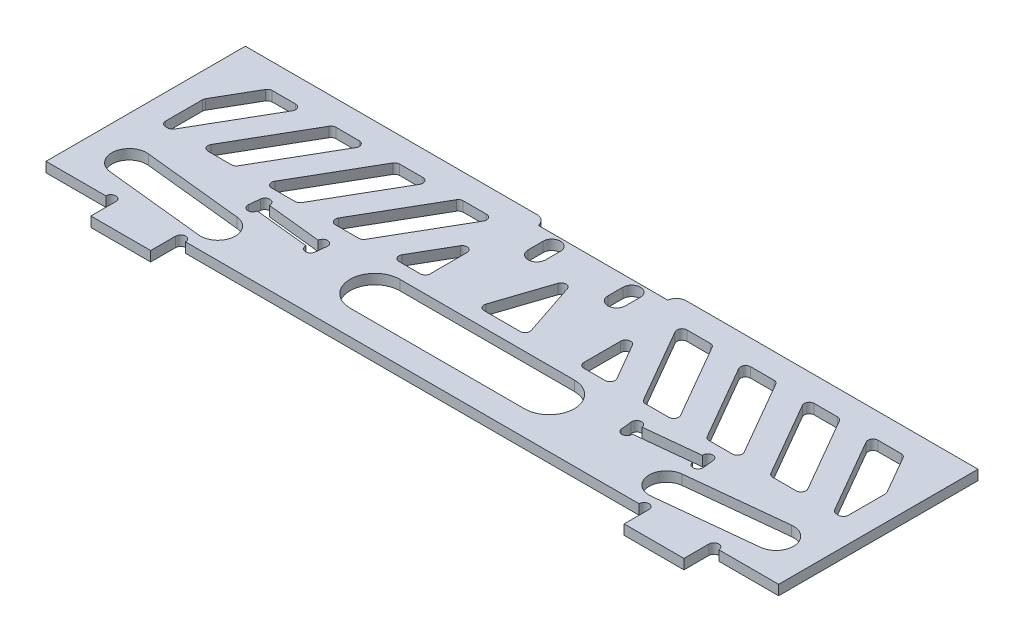
from build123d import *

# Parameters (mm, degrees)
SKETCH_1_W          = 147
SKETCH_1_H          = 40
EXTRUDE_1_DEPTH     = 2
CUT_EXTRUDE_1_DEPTH = 77.198753271
SKETCH_3_R          = 1
CUT_EXTRUDE_2_DEPTH = 77.198753271
SKETCH_5_W          = 12
SKETCH_5_H          = 2
EXTRUDE_2_DEPTH     = 5
SKETCH_7_R          = 1
CUT_EXTRUDE_3_DEPTH = 78.661122835
CUT_EXTRUDE_5_DEPTH = 78.661122835
SKETCH_11_W         = 26
SKETCH_11_H         = 3.5
CUT_EXTRUDE_6_DEPTH = 10
FILLET_1_R          = 2
CUT_EXTRUDE_7_DEPTH = 78.661122835
CUT_EXTRUDE_8_DEPTH = 10
FILLET_2_R          = 1
CUT_EXTRUDE_9_DEPTH = 10
FILLET_3_R          = 1


with BuildPart() as part:
    # 草图1 → 凸台-拉伸1 (new body)
    with BuildSketch(Plane(origin=(0, 0, 0), x_dir=(1, 0, 0), z_dir=(0, 1, 0))):
        Rectangle(SKETCH_1_W, SKETCH_1_H)
    extrude(amount=EXTRUDE_1_DEPTH)

    # 草图2 → 切除-拉伸1 (cut, through all)
    with BuildSketch(Plane(origin=(0, 2, 0), x_dir=(1, 0, 0), z_dir=(0, 1, 0))):
        Polygon((-45.658720859, -7.223049229), (-45.42875824, -5.035101059), (-30.51092981, -6.603028008), (-30.740892429, -8.790976178), align=None)
    cut_extrude_1 = extrude(amount=-CUT_EXTRUDE_1_DEPTH, mode=Mode.SUBTRACT)

    # 草图3 → 切除-拉伸2 (cut, through all)
    with BuildSketch(Plane(origin=(0, 2, 0), x_dir=(1, 0, 0), z_dir=(0, 1, 0))):
        with Locations((-44.434236345, -5.139629522)):
            Circle(SKETCH_3_R)
        with Locations((-44.664198964, -7.327577692)):
            Circle(SKETCH_3_R)
        with Locations((-31.505451705, -6.498499545)):
            Circle(SKETCH_3_R)
        with Locations((-31.735414324, -8.686447714)):
            Circle(SKETCH_3_R)
    cut_extrude_2 = extrude(amount=-CUT_EXTRUDE_2_DEPTH, mode=Mode.SUBTRACT)

    # 镜向1: 切除-拉伸1, 切除-拉伸2 across plane
    add(cut_extrude_1.mirror(Plane(origin=(0, 0, 0), x_dir=(0, 0, 1), z_dir=(1, 0, 0))), mode=Mode.SUBTRACT)
    add(cut_extrude_2.mirror(Plane(origin=(0, 0, 0), x_dir=(0, 0, 1), z_dir=(1, 0, 0))), mode=Mode.SUBTRACT)

    # 草图5 → 凸台-拉伸2 (add)
    with BuildSketch(Plane.XY.offset(20)):
        with Locations((53.5, 1)):
            Rectangle(SKETCH_5_W, SKETCH_5_H)
        with Locations((-53.5, 1)):
            Rectangle(SKETCH_5_W, SKETCH_5_H)
    extrude(amount=EXTRUDE_2_DEPTH)

    # 草图7 → 切除-拉伸3 (cut, through all)
    with BuildSketch(Plane(origin=(0, 2, 0), x_dir=(1, 0, 0), z_dir=(0, 1, 0))):
        with Locations((60.5, -20)):
            Circle(SKETCH_7_R)
        with Locations((46.5, -20)):
            Circle(SKETCH_7_R)
        with Locations((-46.5, -20)):
            Circle(SKETCH_7_R)
        with Locations((-60.5, -20)):
            Circle(SKETCH_7_R)
    extrude(amount=-CUT_EXTRUDE_3_DEPTH, mode=Mode.SUBTRACT)

    # 草图10 → 切除-拉伸5 (cut, through all)
    with BuildSketch(Plane(origin=(0, 2, 0), x_dir=(1, 0, 0), z_dir=(0, 1, 0))):
        with BuildLine():
            Line((-64.524588286, -8.428604101), (-44.634150379, -10.519173366))
            ThreePointArc((-44.634150379, -10.519173366), (-41.519173366, -14.365849621), (-45.365849621, -17.480826634))
            Line((-45.365849621, -17.480826634), (-65.256287529, -15.390257368))
            ThreePointArc((-65.256287529, -15.390257368), (-68.371264541, -11.543581113), (-64.524588286, -8.428604101))
        make_face()
    cut_extrude_5 = extrude(amount=-CUT_EXTRUDE_5_DEPTH, mode=Mode.SUBTRACT)

    # 镜向2: 切除-拉伸5 across plane
    add(cut_extrude_5.mirror(Plane(origin=(0, 0, 0), x_dir=(0, 0, 1), z_dir=(1, 0, 0))), mode=Mode.SUBTRACT)

    # 草图11 → 切除-拉伸6 (cut)
    with BuildSketch(Plane(origin=(0, 2, 0), x_dir=(1, 0, 0), z_dir=(0, 1, 0))):
        with Locations((0, 20)):
            Rectangle(SKETCH_11_W, SKETCH_11_H)
    extrude(amount=-CUT_EXTRUDE_6_DEPTH, mode=Mode.SUBTRACT)

    # 圆角1
    # the kernel refuses this fillet: 2 mm, written as the material it takes off along each edge
    with BuildSketch(Plane(origin=(13, -4.960783708, -20), x_dir=(1, 0, 0), z_dir=(0, 1, 0)), Plane(origin=(-13, 6.960783708, -20), x_dir=(-1, 0, 0), z_dir=(0, -1, 0))) as fillet_1_piece_1:
        with BuildLine():
            CenterArc((1.984313483, -2), FILLET_1_R, 90, 82.819244219)
            Line((0, -1.75), (-0.03968627, -1.745))
            ThreePointArc((-0.03968627, -1.745), (-0.04, -0.875), (-0.04, 0))
            Line((-0.04, 0), (0, 0.04))
            Line((0, 0.04), (1.984313483, 0.04))
            Line((1.984313483, 0.04), (1.984313483, 0))
        make_face()
    extrude(amount=11.921567416, mode=Mode.SUBTRACT)

    # 草图12 → 切除-拉伸7 (cut, through all)
    with BuildSketch(Plane(origin=(0, 2, 0), x_dir=(1, 0, 0), z_dir=(0, 1, 0))):
        with BuildLine():
            Line((-6.25, 16), (-6.25, 13))
            ThreePointArc((-6.25, 13), (-8, 11.25), (-9.75, 13))
            Line((-9.75, 13), (-9.75, 16))
            ThreePointArc((-9.75, 16), (-8, 17.75), (-6.25, 16))
        make_face()
        with BuildLine():
            Line((9.75, 16), (9.75, 13))
            ThreePointArc((9.75, 13), (8, 11.25), (6.25, 13))
            Line((6.25, 13), (6.25, 16))
            ThreePointArc((6.25, 16), (8, 17.75), (9.75, 16))
        make_face()
    extrude(amount=-CUT_EXTRUDE_7_DEPTH, mode=Mode.SUBTRACT)

    # 草图13 → 切除-拉伸8 (cut)
    with BuildSketch(Plane(origin=(0, 2, 0), x_dir=(1, 0, 0), z_dir=(0, 1, 0))):
        with BuildLine():
            Line((-17.5, -5), (17.5, -5))
            ThreePointArc((17.5, -5), (22.5, -10), (17.5, -15))
            Line((17.5, -15), (-17.5, -15))
            ThreePointArc((-17.5, -15), (-22.5, -10), (-17.5, -5))
        make_face()
        Polygon((0, 13), (-5, -2), (5, -2), align=None)
    extrude(amount=-CUT_EXTRUDE_8_DEPTH, mode=Mode.SUBTRACT)

    # 圆角2
    fillet_2_edges = [part.edges().sort_by_distance(p)[0] for p in [
        (0, 1, -13),
        (5, 1, 2),
        (-5, 1, 2),
    ]]
    fillet(fillet_2_edges, radius=FILLET_2_R)

    # 草图14 → 切除-拉伸9 (cut)
    with BuildSketch(Plane(origin=(0, 2, 0), x_dir=(1, 0, 0), z_dir=(0, 1, 0))):
        Polygon((-56.685045424, 15), (-63.685045424, 15), (-68.5, 6.660254038), (-68.5, -2), (-66.5, -2), align=None)
        Polygon((-60.726497308, -2), (-53.726497308, -2), (-43.911542732, 15), (-50.911542732, 15), align=None)
        Polygon((-47.952994616, -2), (-40.952994616, -2), (-31.13804004, 15), (-38.13804004, 15), align=None)
        Polygon((-35.179491924, -2), (-28.179491924, -2), (-18.364537348, 15), (-25.364537348, 15), align=None)
        Polygon((-22.405989232, -2), (-15.405989232, -2), (-15.405989232, 10.124355653), align=None)
        Polygon((15.405989232, 10.124355653), (22.405989232, -2), (15.405989232, -2), align=None)
        Polygon((18.364537348, 15), (25.364537348, 15), (35.179491924, -2), (28.179491924, -2), align=None)
        Polygon((40.952994616, -2), (31.13804004, 15), (38.13804004, 15), (47.952994616, -2), align=None)
        Polygon((43.911542732, 15), (50.911542732, 15), (60.726497308, -2), (53.726497308, -2), align=None)
        Polygon((68.5, -2), (68.5, 6.660254038), (63.685045424, 15), (56.685045424, 15), (66.5, -2), align=None)
    extrude(amount=-CUT_EXTRUDE_9_DEPTH, mode=Mode.SUBTRACT)

    # 圆角3
    fillet_3_edges = [part.edges().sort_by_distance(p)[0] for p in [
        (-28.179491924, 1, 2),
        (-35.179491924, 1, 2),
        (-25.364537348, 1, -15),
        (-18.364537348, 1, -15),
        (-15.405989232, 1, 2),
        (-22.405989232, 1, 2),
        (-15.405989232, 1, -10.124355653),
        (-53.726497308, 1, 2),
        (-60.726497308, 1, 2),
        (-50.911542732, 1, -15),
        (-43.911542732, 1, -15),
        (-40.952994616, 1, 2),
        (-47.952994616, 1, 2),
        (-38.13804004, 1, -15),
        (-31.13804004, 1, -15),
        (40.952994616, 1, 2),
        (31.13804004, 1, -15),
        (38.13804004, 1, -15),
        (47.952994616, 1, 2),
        (43.911542732, 1, -15),
        (50.911542732, 1, -15),
        (60.726497308, 1, 2),
        (53.726497308, 1, 2),
        (15.405989232, 1, -10.124355653),
        (22.405989232, 1, 2),
        (15.405989232, 1, 2),
        (18.364537348, 1, -15),
        (25.364537348, 1, -15),
        (35.179491924, 1, 2),
        (28.179491924, 1, 2),
        (63.685045424, 1, -15),
        (68.5, 1, -6.660254038),
        (68.5, 1, 2),
        (66.5, 1, 2),
        (56.685045424, 1, -15),
        (-68.5, 1, -6.660254038),
        (-63.685045424, 1, -15),
        (-56.685045424, 1, -15),
        (-66.5, 1, 2),
        (-68.5, 1, 2),
    ]]
    fillet(fillet_3_edges, radius=FILLET_3_R)


solid = part.part
